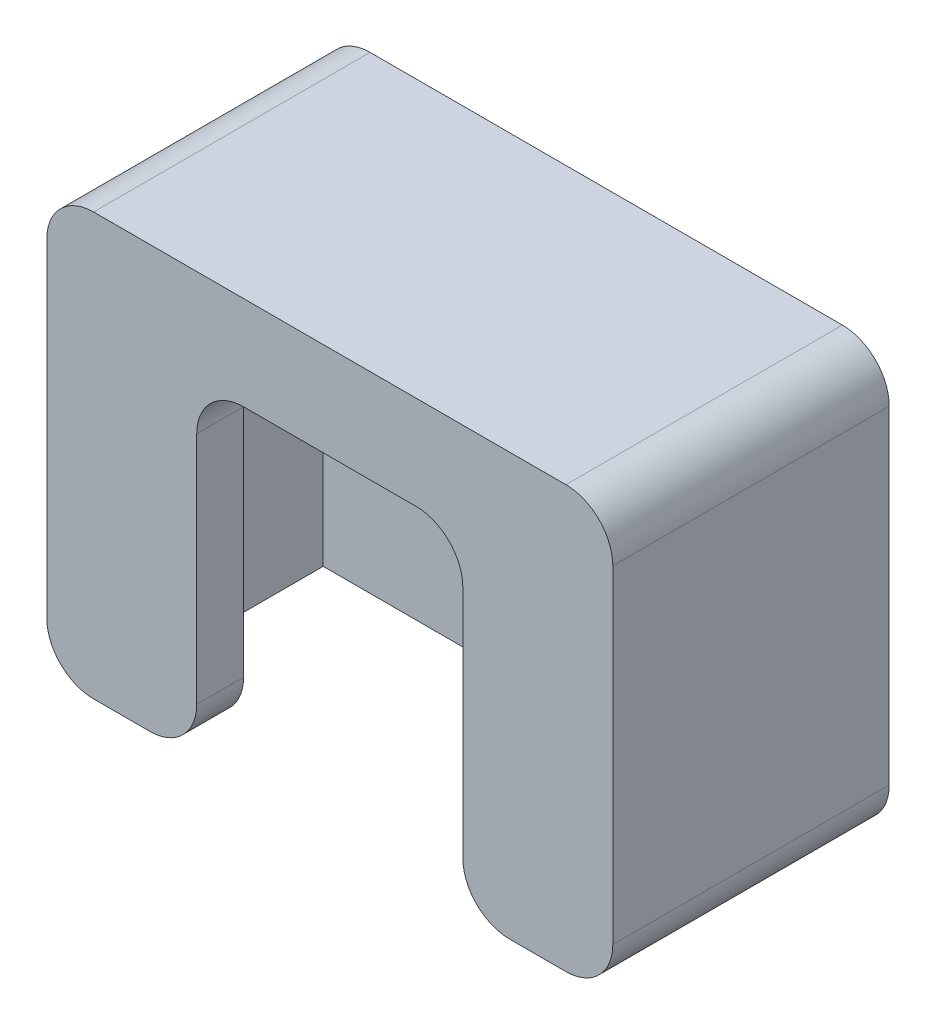
from build123d import *

# Parameters (mm, degrees)
SKETCH1_W           = 30.2
SKETCH1_H           = 14.75
SKETCH1_W_2         = 25.2
SKETCH1_H_2         = 9.75
BOSS_EXTRUDE1_DEPTH = 20
SKETCH2_W           = 30.2
SKETCH2_H           = 14.75
BOSS_EXTRUDE2_DEPTH = 2.5
SKETCH3_W           = 14.2
SKETCH3_H           = 17.5
CUT_EXTRUDE1_DEPTH  = 2.5
FILLET1_R           = 2.5
FILLET2_R           = 2.5
FILLET3_START       = -8
FILLET3_DEPTH       = 16
FILLET3_START_2     = 4.875
FILLET3_2_DEPTH     = 3.125
FILLET3_3_DEPTH     = 2.5


with BuildPart() as part:
    # Sketch1 → Boss-Extrude1 (new body)
    with BuildSketch(Plane(origin=(0, 0, 0), x_dir=(1, 0, 0), z_dir=(0, 1, 0))):
        Rectangle(SKETCH1_W, SKETCH1_H)
        Rectangle(SKETCH1_W_2, SKETCH1_H_2, mode=Mode.SUBTRACT)
    extrude(amount=BOSS_EXTRUDE1_DEPTH)

    # Sketch2 → Boss-Extrude2 (add)
    with BuildSketch(Plane(origin=(0, 20, 0), x_dir=(1, 0, 0), z_dir=(0, 1, 0))):
        Rectangle(SKETCH2_W, SKETCH2_H)
    extrude(amount=BOSS_EXTRUDE2_DEPTH)

    # Sketch3 → Cut-Extrude1 (cut)
    with BuildSketch(Plane.XY.offset(7.375)):
        with Locations((0, 8.75)):
            Rectangle(SKETCH3_W, SKETCH3_H)
    extrude(amount=-CUT_EXTRUDE1_DEPTH, mode=Mode.SUBTRACT)

    # Fillet1
    fillet1_edges = [part.edges().sort_by_distance(p)[0] for p in [
        (-15.1, 22.5, 0),
        (15.1, 22.5, 0),
    ]]
    fillet(fillet1_edges, radius=FILLET1_R)

    # Fillet2
    fillet2_edges = [part.edges().sort_by_distance(p)[0] for p in [
        (12.6, 20, 0),
        (-12.6, 20, 0),
    ]]
    fillet(fillet2_edges, radius=FILLET2_R)

    # Fillet3: read off the stored shape, not the designer's step
    # Fillet3 outline → Fillet3 (cut)
    with BuildSketch(Plane.XY.offset(FILLET3_START)):
        with BuildLine():
            Line((-15.1, 0), (-12.6, 0))
            ThreePointArc((-12.6, 0), (-14.367766953, 0.732233047), (-15.1, 2.5))
            Line((-15.1, 2.5), (-15.1, 0))
        make_face()
        with BuildLine():
            ThreePointArc((15.1, 2.5), (14.367766953, 0.732233047), (12.6, 0))
            Line((12.6, 0), (15.1, 0))
            Line((15.1, 0), (15.1, 2.5))
        make_face()
    extrude(amount=FILLET3_DEPTH, mode=Mode.SUBTRACT)

    # Fillet3 2 outline → Fillet3 2 (cut)
    with BuildSketch(Plane.XY.offset(FILLET3_START_2)):
        with BuildLine():
            ThreePointArc((-7.1, 2.5), (-7.832233047, 0.732233047), (-9.6, 0))
            Line((-9.6, 0), (-7.1, 0))
            Line((-7.1, 0), (-7.1, 2.5))
        make_face()
        with BuildLine():
            Line((7.1, 2.5), (7.1, 0))
            Line((7.1, 0), (9.6, 0))
            ThreePointArc((9.6, 0), (7.832233047, 0.732233047), (7.1, 2.5))
        make_face()
    extrude(amount=FILLET3_2_DEPTH, mode=Mode.SUBTRACT)

    # Fillet3 3 outline → Fillet3 3 (add)
    with BuildSketch(Plane.XY.offset(FILLET3_START_2)):
        with BuildLine():
            Line((-7.1, 17.5), (-7.1, 15))
            ThreePointArc((-7.1, 15), (-6.367766953, 16.767766953), (-4.6, 17.5))
            Line((-4.6, 17.5), (-7.1, 17.5))
        make_face()
        with BuildLine():
            Line((7.1, 17.5), (4.6, 17.5))
            ThreePointArc((4.6, 17.5), (6.367766953, 16.767766953), (7.1, 15))
            Line((7.1, 15), (7.1, 17.5))
        make_face()
    extrude(amount=FILLET3_3_DEPTH)


solid = part.part
